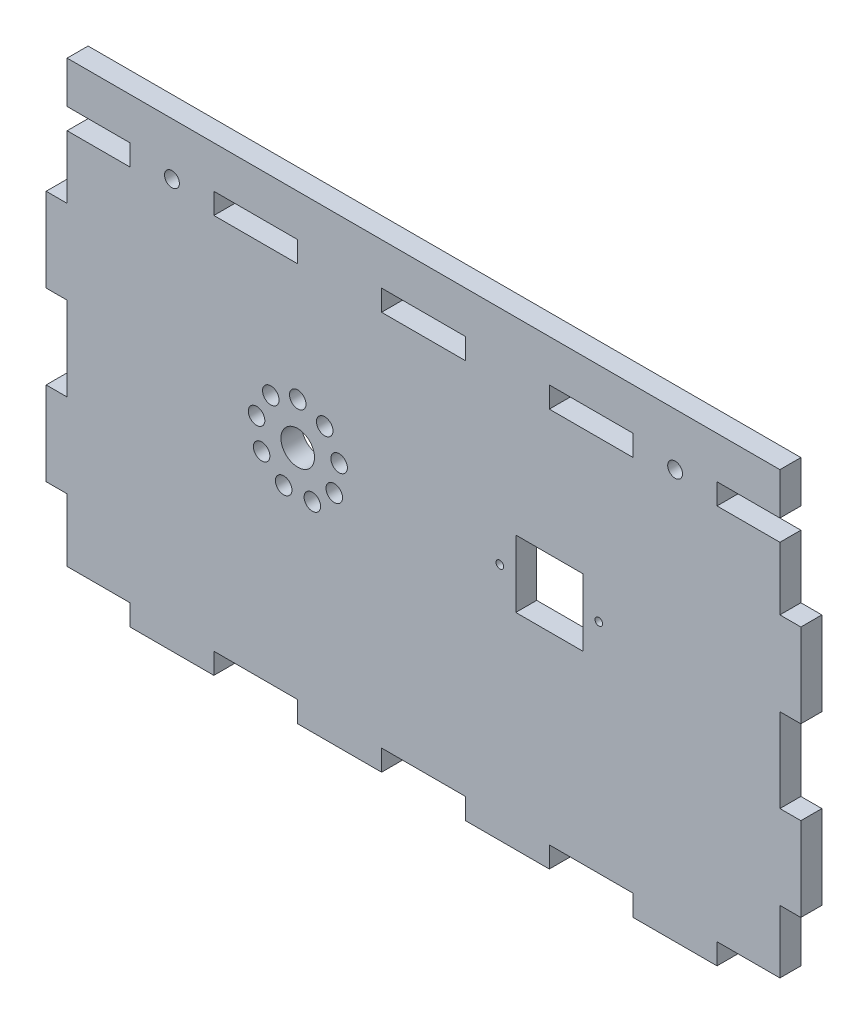
from build123d import *

# Parameters (mm, degrees)
SKETCH1_W                 = 228.6
SKETCH1_H                 = 139.7
BOSS_EXTRUDE1_DEPTH       = 6.35
SKETCH5_W                 = 6.35
SKETCH5_H                 = 25.4
CUT_EXTRUDE4_DEPTH        = 6.35
SKETCH6_W                 = 25.4
SKETCH6_H                 = 6.35
CUT_EXTRUDE5_DEPTH        = 6.35
LPATTERN5_COUNT           = 3
LPATTERN5_PITCH           = 50.8
LPATTERN5_COUNT_DIR2      = 2
LPATTERN5_PITCH_DIR2      = 222.25
LPATTERN6_COUNT           = 5
LPATTERN6_PITCH           = 50.8
LPATTERN6_COUNT_DIR2      = 2
LPATTERN6_PITCH_DIR2      = 120.65
SKETCH7_W                 = 6.35
SKETCH7_H                 = 19.05
CUT_EXTRUDE6_DEPTH        = 6.35
SKETCH8_W                 = 6.35
SKETCH8_H                 = 19.05
CUT_EXTRUDE7_DEPTH        = 6.35
F_8_CLEARANCE_HOLE1_D     = 4.4958
F_8_CLEARANCE_HOLE1_DEPTH = 10.16
F_8_CLEARANCE_HOLE1_TIP   = 1.350674586
SKETCH11_R                = 1.143
SKETCH11_W                = 20.32
SKETCH11_H                = 20.32
CUT_EXTRUDE8_DEPTH        = 7.62
SKETCH12_R                = 5.08
CUT_EXTRUDE9_DEPTH        = 7.62
SKETCH13_R                = 2.5
CUT_EXTRUDE10_DEPTH       = 7.62


with BuildPart() as part:
    # Sketch1 → Boss-Extrude1 (new body)
    with BuildSketch(Plane.XY):
        with Locations((114.3, 69.85)):
            Rectangle(SKETCH1_W, SKETCH1_H)
    extrude(amount=BOSS_EXTRUDE1_DEPTH)

    # Sketch5 → Cut-Extrude4 (cut)
    with BuildSketch(Plane.XY.offset(6.35)):
        with Locations((3.175, 12.7)):
            Rectangle(SKETCH5_W, SKETCH5_H)
    cut_extrude4 = extrude(amount=-CUT_EXTRUDE4_DEPTH, mode=Mode.SUBTRACT)

    # Sketch6 → Cut-Extrude5 (cut)
    with BuildSketch(Plane.XY.offset(6.35)):
        with Locations((12.7, 3.175)):
            Rectangle(SKETCH6_W, SKETCH6_H)
    cut_extrude5 = extrude(amount=-CUT_EXTRUDE5_DEPTH, mode=Mode.SUBTRACT)

    # LPattern5: Cut-Extrude4 3 × 2
    with Locations(*[(j * LPATTERN5_PITCH_DIR2, i * LPATTERN5_PITCH, 0) for i in range(LPATTERN5_COUNT) for j in range(LPATTERN5_COUNT_DIR2) if (i, j) != (0, 0)]):
        add(cut_extrude4, mode=Mode.SUBTRACT)

    # LPattern6: Cut-Extrude5 5 × 2
    with Locations(*[(i * LPATTERN6_PITCH, j * LPATTERN6_PITCH_DIR2, 0) for i in range(LPATTERN6_COUNT) for j in range(LPATTERN6_COUNT_DIR2) if (i, j) != (0, 0)]):
        add(cut_extrude5, mode=Mode.SUBTRACT)

    # Sketch7 → Cut-Extrude6 (cut)
    with BuildSketch(Plane.XY.offset(6.35)):
        with Locations((3.175, 130.175)):
            Rectangle(SKETCH7_W, SKETCH7_H)
    extrude(amount=-CUT_EXTRUDE6_DEPTH, mode=Mode.SUBTRACT)

    # Sketch8 → Cut-Extrude7 (cut)
    with BuildSketch(Plane.XY.offset(6.35)):
        with Locations((225.425, 130.175)):
            Rectangle(SKETCH8_W, SKETCH8_H)
    extrude(amount=-CUT_EXTRUDE7_DEPTH, mode=Mode.SUBTRACT)

    # #8 Clearance Hole1
    with Locations(Plane.XY.offset(6.35)):
        with Locations((38.1, 123.825), (190.5, 123.825)):
            Hole(F_8_CLEARANCE_HOLE1_D / 2, depth=F_8_CLEARANCE_HOLE1_DEPTH)
            with Locations((0, 0, -(F_8_CLEARANCE_HOLE1_DEPTH + F_8_CLEARANCE_HOLE1_TIP / 2))):  # 118° drill point
                Cone(0, F_8_CLEARANCE_HOLE1_D / 2, F_8_CLEARANCE_HOLE1_TIP, mode=Mode.SUBTRACT)

    # Sketch11 → Cut-Extrude8 (cut)
    with BuildSketch(Plane.XY.offset(6.35)):
        with Locations((137.414, 72.39)):
            Circle(SKETCH11_R)
        with Locations((167.386, 72.39)):
            Circle(SKETCH11_R)
        with Locations((152.4, 72.39)):
            Rectangle(SKETCH11_W, SKETCH11_H)
    extrude(amount=-CUT_EXTRUDE8_DEPTH, mode=Mode.SUBTRACT)

    # Sketch12 → Cut-Extrude9 (cut)
    with BuildSketch(Plane.XY.offset(6.35)):
        with Locations((76.2, 72.39)):
            Circle(SKETCH12_R)
    extrude(amount=-CUT_EXTRUDE9_DEPTH, mode=Mode.SUBTRACT)

    # Sketch13 → Cut-Extrude10 (cut)
    with BuildSketch(Plane.XY.offset(6.35)):
        with Locations((76.2, 85.09)):
            Circle(SKETCH13_R)
        with Locations((84.373925913, 82.147676874)):
            Circle(SKETCH13_R)
        with Locations((88.744227587, 74.639628293)):
            Circle(SKETCH13_R)
        with Locations((87.2659923, 66.078953633)):
            Circle(SKETCH13_R)
        with Locations((80.63090277, 60.471287707)):
            Circle(SKETCH13_R)
        with Locations((71.943591129, 60.440519725)):
            Circle(SKETCH13_R)
        with Locations((65.268947043, 66.001046367)):
            Circle(SKETCH13_R)
        with Locations((63.730110661, 74.551035419)):
            Circle(SKETCH13_R)
        with Locations((68.047120627, 82.089851982)):
            Circle(SKETCH13_R)
    extrude(amount=-CUT_EXTRUDE10_DEPTH, mode=Mode.SUBTRACT)


solid = part.part
